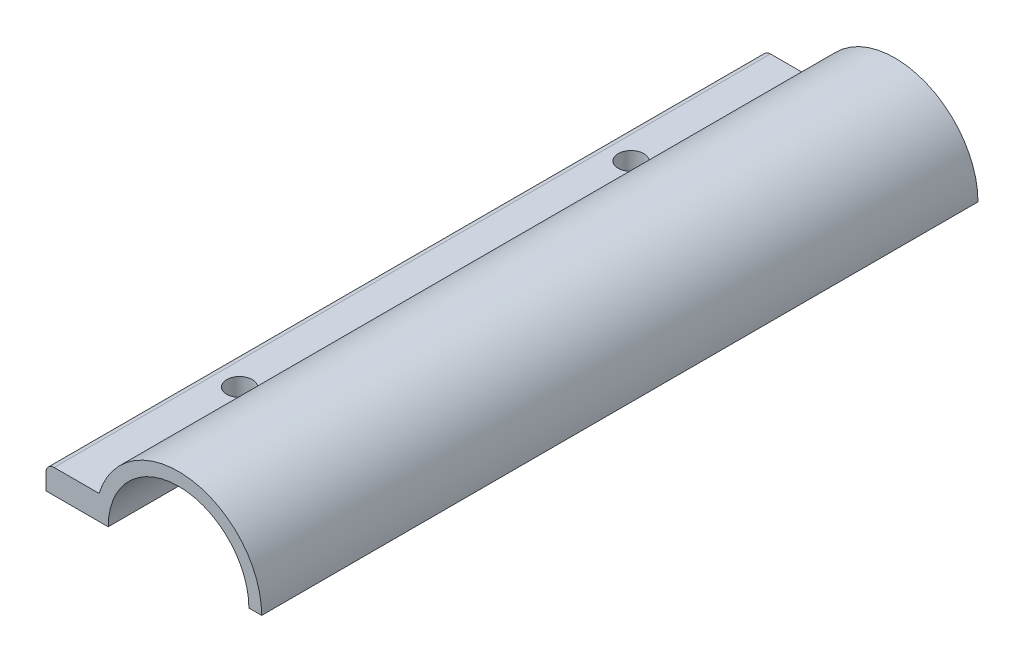
from build123d import *

# Parameters (mm, degrees)
BOSS_EXTRUDE1_DEPTH = 112
SKETCH3_R           = 2
CUT_EXTRUDE2_DEPTH  = 115.271427971
FILLET1_R           = 1.27


with BuildPart() as part:
    # Sketch1 → Boss-Extrude1 (new body)
    with BuildSketch(Plane.XY):
        with BuildLine():
            Line((-12.429155241, 3.81), (-20.724457785, 3.81))
            Line((-20.724457785, 3.81), (-20.724457785, 0))
            Line((-20.724457785, 0), (-11, 0))
            ThreePointArc((-11, 0), (0, 11), (11, 0))
            Line((11, 0), (13, 0))
            ThreePointArc((13, 0), (1.926263465, 12.856496765), (-12.429155241, 3.81))
        make_face()
    extrude(amount=BOSS_EXTRUDE1_DEPTH)

    # Sketch3 → Cut-Extrude2 (cut, through all)
    with BuildSketch(Plane(origin=(0, 3.81, 0), x_dir=(1, 0, 0), z_dir=(0, 1, 0))):
        with Locations((-15.862228893, -25.4)):
            Circle(SKETCH3_R)
        with Locations((-15.862228893, -86.6)):
            Circle(SKETCH3_R)
    extrude(amount=-CUT_EXTRUDE2_DEPTH, mode=Mode.SUBTRACT)

    # Fillet1
    fillet1_edges = [part.edges().sort_by_distance(p)[0] for p in [
        (-20.724457785, 3.81, 56),
    ]]
    fillet(fillet1_edges, radius=FILLET1_R)


solid = part.part
